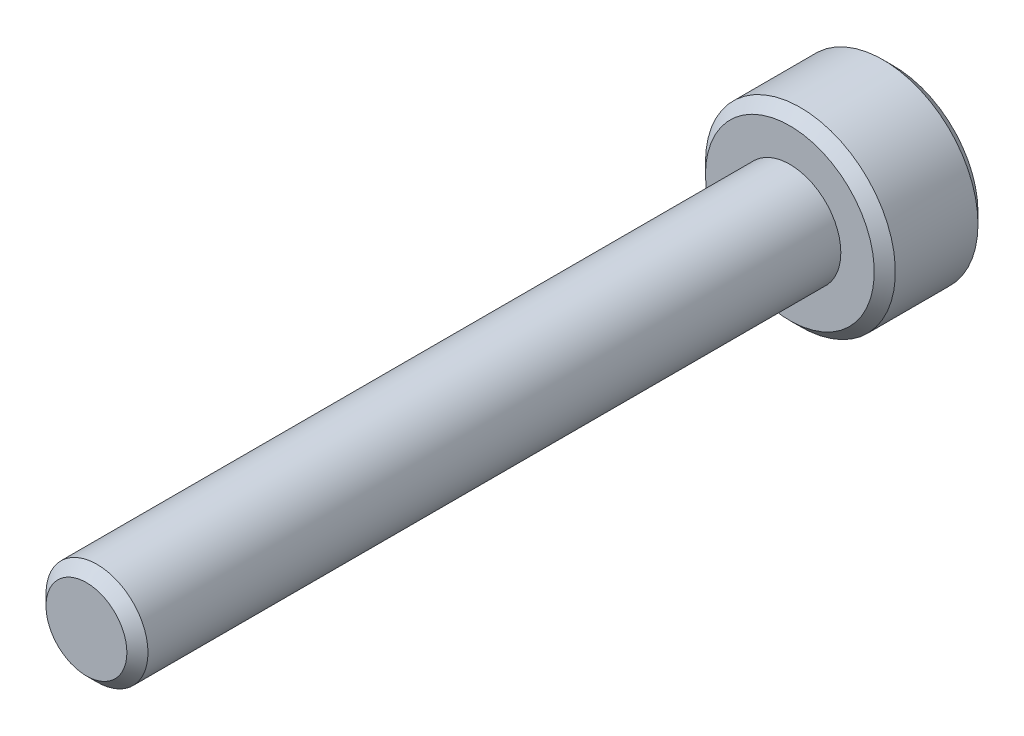
from build123d import *

# Parameters (mm, degrees)
SKIZZE1_R                       = 2.7
AUFSATZ_LINEAR_AUSTRAGEN1_DEPTH = 2.95
SKIZZE2_R                       = 1.45
AUFSATZ_LINEAR_AUSTRAGEN2_DEPTH = 20
FASE1_SIZE                      = 0.3
SCHNITT_LINEAR_AUSTRAGEN1_DEPTH = 2.5


with BuildPart() as part:
    # Skizze1 → Aufsatz-Linear austragen1 (new body)
    with BuildSketch(Plane.XY):
        Circle(SKIZZE1_R)
    extrude(amount=AUFSATZ_LINEAR_AUSTRAGEN1_DEPTH)

    # Skizze2 → Aufsatz-Linear austragen2 (add)
    with BuildSketch(Plane.XY.offset(2.95)):
        Circle(SKIZZE2_R)
    extrude(amount=AUFSATZ_LINEAR_AUSTRAGEN2_DEPTH)

    # Fase1
    fase1_edges = [part.edges().sort_by_distance(p)[0] for p in [
        (-2.7, 0, 2.95),
        (-2.7, 0, 0),
        (-1.45, 0, 22.95),
    ]]
    chamfer(fase1_edges, length=FASE1_SIZE)

    # Skizze3 → Schnitt-Linear austragen1 (cut)
    with BuildSketch(Plane(origin=(0, 0, 0), x_dir=(-1, 0, 0), z_dir=(0, 0, -1))):
        Polygon((1.25, 0.721687836), (0, 1.443375673), (-1.25, 0.721687836), (-1.25, -0.721687836), (0, -1.443375673), (1.25, -0.721687836), align=None)
    extrude(amount=-SCHNITT_LINEAR_AUSTRAGEN1_DEPTH, mode=Mode.SUBTRACT)


solid = part.part
